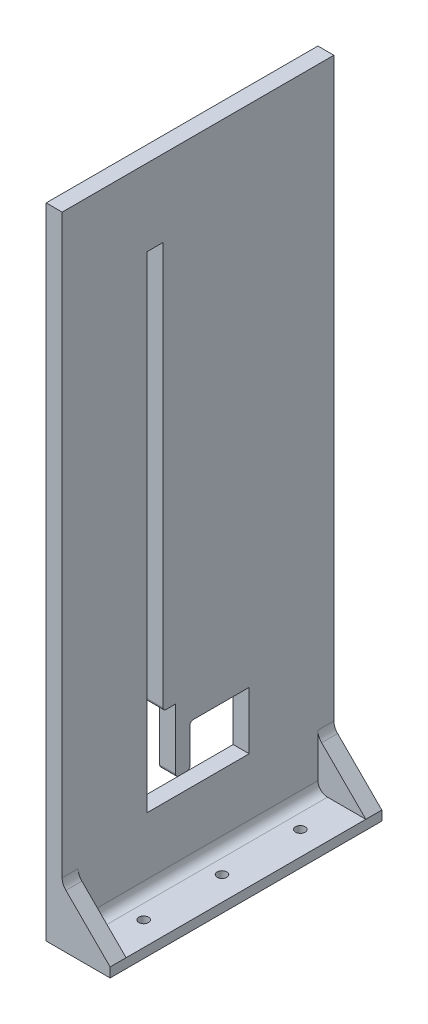
from build123d import *

# Parameters (mm, degrees)
SKETCH1_W               = 85
SKETCH1_H               = 200
BOSS_EXTRUDE1_DEPTH     = 5
FILLET1_R               = 1
SKETCH2_R               = 17.5
CUT_EXTRUDE1_DEPTH      = 2.5
FILLET2_R               = 0.125
SKETCH3_W               = 15
SKETCH3_H               = 85
BOSS_EXTRUDE2_DEPTH     = 3
RIB1_START              = -5
RIB1_DEPTH              = 5
SKETCH5_R               = 1.5
CUT_EXTRUDE2_DEPTH      = 3
FILLET3_R               = 4
FILLET4_R               = 3
MIRROR3_START           = -5
MIRROR3_COPY_1_DEPTH    = 5
FILLET5_R               = 4
FILLET6_R               = 3
CUT_EXTRUDE3_DEPTH      = 219.231528428
CUT_EXTRUDE3_DEPTH_BACK = 219.231528428
SKETCH7_R               = 17.5
BOSS_EXTRUDE3_DEPTH     = 2.5


# Read off the part's stored shape, not the designer's step: Rib1
with BuildPart() as part:
    # Sketch1 → Boss-Extrude1 (new body)
    with BuildSketch(Plane(origin=(0, 0, 0), x_dir=(0, 0, -1), z_dir=(1, 0, 0))):
        with Locations((0, 100)):
            Rectangle(SKETCH1_W, SKETCH1_H)
        Polygon((-16, 25), (-16, 176), (-11, 176), (-11, 49), (-7, 49), (-7, 29), (-2.5, 29), (-2.5, 42), (16, 42), (16, 25), (16, 24), (15, 24), (-15, 24), (-16, 24), align=None, mode=Mode.SUBTRACT)
    extrude(amount=BOSS_EXTRUDE1_DEPTH)

    # Fillet1
    fillet1_edges = [part.edges().sort_by_distance(p)[0] for p in [
        (2.5, 42, 2.5),
        (2.5, 29, 2.5),
        (2.5, 29, 7),
        (2.5, 49, 11),
    ]]
    fillet(fillet1_edges, radius=FILLET1_R)

    # Sketch2 → Cut-Extrude1 (cut)
    with BuildSketch(Plane(origin=(5, 0, 0), x_dir=(0, 0, -1), z_dir=(1, 0, 0))):
        with Locations((15.75, 173.25)):
            Circle(SKETCH2_R)
        Polygon((15.75, 173.125), (15.625, 173.25), (8.75, 173.25), (15.75, 187.25), (15.75, 173.375), (15.875, 173.25), (22.75, 173.25), (15.75, 159.25), align=None, mode=Mode.SUBTRACT)
    cut_extrude1 = extrude(amount=-CUT_EXTRUDE1_DEPTH, mode=Mode.SUBTRACT)

    # Fillet2
    fillet2_edges = [part.edges().sort_by_distance(p)[0] for p in [
        (3.75, 173.25, -15.625),
        (3.75, 173.125, -15.75),
        (3.75, 173.25, -15.875),
        (3.75, 173.375, -15.75),
    ]]
    fillet(fillet2_edges, radius=FILLET2_R)

    # Sketch3 → Boss-Extrude2 (add)
    with BuildSketch(Plane.XZ):
        with Locations((-7.5, 0)):
            Rectangle(SKETCH3_W, SKETCH3_H)
    boss_extrude2 = extrude(amount=-BOSS_EXTRUDE2_DEPTH)

    # Rib1 outline → Rib1 (add)
    with BuildSketch(Plane.XY.offset(42.5).offset(RIB1_START)):
        Polygon((0, 18), (-15, 3), (0, 3), align=None)
    rib1 = extrude(amount=RIB1_DEPTH)

    # Mirror1: Rib1 across plane
    add(rib1.mirror(Plane.XY))

    # Sketch5 → Cut-Extrude2 (cut)
    with BuildSketch(Plane(origin=(0, 3, 0), x_dir=(1, 0, 0), z_dir=(0, 1, 0))):
        with Locations(Location((-7.5, 24.5, 0), (0, 0, 270))):
            Circle(SKETCH5_R)
        with Locations(Location((-7.5, 0, 0), (0, 0, 270))):
            Circle(SKETCH5_R)
        with Locations(Location((-7.5, -24.5, 0), (0, 0, 270))):
            Circle(SKETCH5_R)
    cut_extrude2 = extrude(amount=-CUT_EXTRUDE2_DEPTH, mode=Mode.SUBTRACT)

    # Fillet3
    fillet3_edges = [part.edges().sort_by_distance(p)[0] for p in [
        (0, 18, 40),
        (0, 18, -40),
    ]]
    fillet(fillet3_edges, radius=FILLET3_R)

    # Fillet4
    fillet4_edges = [part.edges().sort_by_distance(p)[0] for p in [
        (0, 3, 0),
    ]]
    fillet(fillet4_edges, radius=FILLET4_R)

    # Mirror3: Boss-Extrude2, Rib1, Cut-Extrude2 across plane
    add(boss_extrude2.mirror(Plane(origin=(2.5, 0, 0), x_dir=(0, 0, 1), z_dir=(1, 0, 0))))
    add(rib1.mirror(Plane(origin=(2.5, 0, 0), x_dir=(0, 0, 1), z_dir=(1, 0, 0))))
    add(cut_extrude2.mirror(Plane(origin=(2.5, 0, 0), x_dir=(0, 0, 1), z_dir=(1, 0, 0))), mode=Mode.SUBTRACT)

    # Mirror3 copy 1 sketch → Mirror3 copy 1 (add)
    with BuildSketch(Plane(origin=(5, 0, -42.5), x_dir=(-1, 0, 0), z_dir=(0, 0, -1)).offset(MIRROR3_START)):
        Polygon((0, 18), (-15, 3), (0, 3), align=None)
    extrude(amount=MIRROR3_COPY_1_DEPTH)

    # Fillet5
    fillet5_edges = [part.edges().sort_by_distance(p)[0] for p in [
        (5, 18, 40),
        (5, 18, -40),
    ]]
    fillet(fillet5_edges, radius=FILLET5_R)

    # Fillet6
    fillet6_edges = [part.edges().sort_by_distance(p)[0] for p in [
        (5, 3, 0),
    ]]
    fillet(fillet6_edges, radius=FILLET6_R)

    # Sketch6 → Cut-Extrude3 (cut, two sides: drawn at the far end of the back side and taken through both)
    with BuildSketch(Plane.XY.offset(42.5).offset(-CUT_EXTRUDE3_DEPTH_BACK)):
        Polygon((0, 24), (0, -5.503420929), (-25.982696809, -6.518277055), (-24.822861237, 19.656854249), align=None)
    extrude(amount=CUT_EXTRUDE3_DEPTH + CUT_EXTRUDE3_DEPTH_BACK, mode=Mode.SUBTRACT)

    # Mirror4: Cut-Extrude1 across plane
    add(cut_extrude1.mirror(Plane(origin=(2.5, 0, 0), x_dir=(0, 0, 1), z_dir=(1, 0, 0))), mode=Mode.SUBTRACT)

    # Sketch7 → Boss-Extrude3 (add)
    with BuildSketch(Plane(origin=(5, 0, 0), x_dir=(0, 0, -1), z_dir=(1, 0, 0))):
        with Locations((15.75, 173.25)):
            Circle(SKETCH7_R)
    extrude(amount=-BOSS_EXTRUDE3_DEPTH)


solid = part.part
